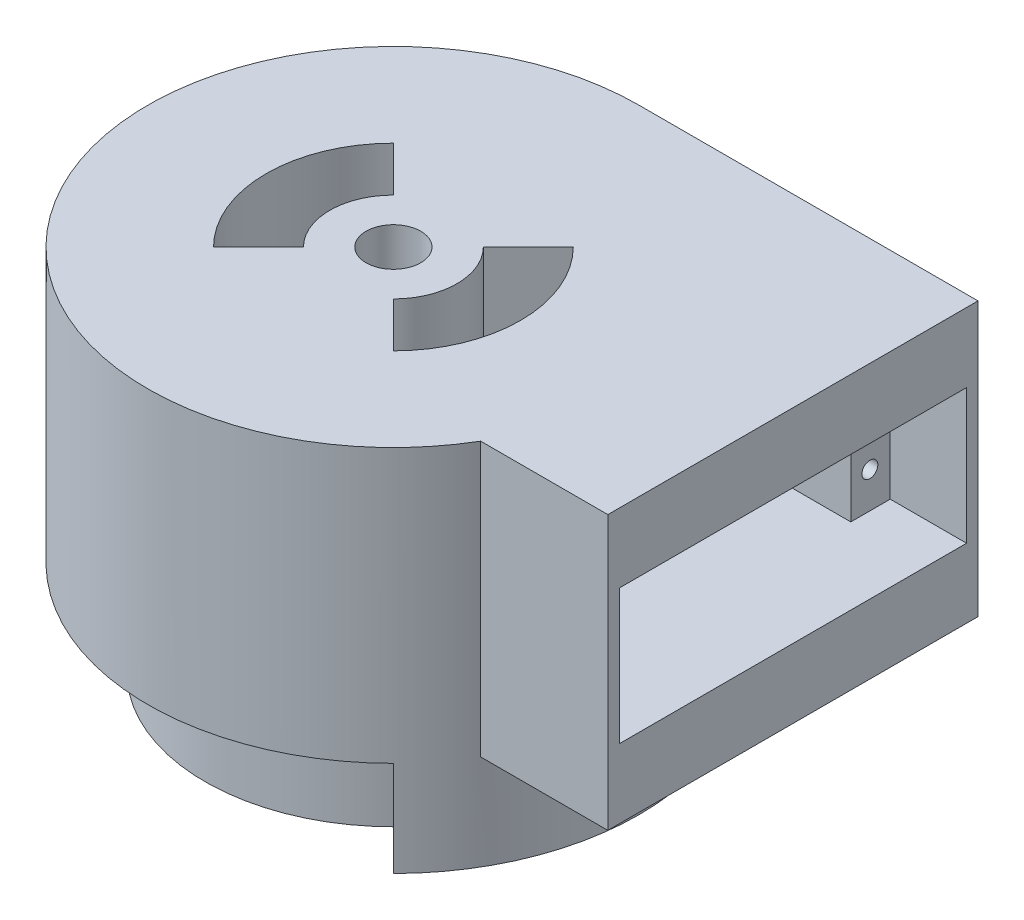
from build123d import *

# Parameters (mm, degrees)
BOSS_EXTRUDE1_DEPTH     = 43
BOSS_EXTRUDE2_START     = 15
BOSS_EXTRUDE2_DEPTH     = 15
SKETCH5_W               = 42.2
SKETCH5_H               = 21.2
CUT_EXTRUDE1_DEPTH      = 41
SKETCH5_5_W             = 6.2
SKETCH5_5_H             = 21.2
SKETCH5_5_R             = 1.25
CUT_EXTRUDE2_DEPTH      = 12
SKETCH5_6_R             = 1.25
CUT_EXTRUDE3_DEPTH      = 35
CUT_EXTRUDE4_DEPTH      = 88.729655833
CUT_EXTRUDE4_DEPTH_BACK = 88.729655833
SKETCH6_R               = 4.3
CUT_EXTRUDE5_START      = -5
SKETCH7_W               = 10
SKETCH7_H               = 6.8
CUT_EXTRUDE5_DEPTH      = 94.632977309


with BuildPart() as part:
    # Sketch1 → Boss-Extrude1 (new body)
    with BuildSketch(Plane(origin=(0, 0, 0), x_dir=(1, 0, 0), z_dir=(0, 1, 0))):
        with BuildLine():
            Line((0, 38.625), (53.297297188, 38.625))
            Line((53.297297188, 38.625), (53.297297188, -19.575))
            Line((53.297297188, -19.575), (33.297297188, -19.575))
            ThreePointArc((33.297297188, -19.575), (-33.525922806, -19.180800948), (0, 38.625))
        make_face()
    extrude(amount=BOSS_EXTRUDE1_DEPTH)

    # Sketch4 → Boss-Extrude2 (add)
    with BuildSketch(Plane.XZ.offset(BOSS_EXTRUDE2_START)):
        with BuildLine():
            Line((20.948038393, 20.948038393), (27.311999423, 27.311999423))
            ThreePointArc((27.311999423, 27.311999423), (38.625, 0), (27.311999423, -27.311999423))
            Line((27.311999423, -27.311999423), (20.948038393, -20.948038393))
            ThreePointArc((20.948038393, -20.948038393), (-29.625, 0), (20.948038393, 20.948038393))
        make_face()
    extrude(amount=-BOSS_EXTRUDE2_DEPTH)

    # Sketch5 → Cut-Extrude1 (cut)
    with BuildSketch(Plane(origin=(53.297297188, 0, 0), x_dir=(0, 0, -1), z_dir=(1, 0, 0))):
        with Locations((9.525, 21.5)):
            Rectangle(SKETCH5_W, SKETCH5_H)
    extrude(amount=-CUT_EXTRUDE1_DEPTH, mode=Mode.SUBTRACT)

    # Sketch5<5> → Cut-Extrude2 (cut)
    # profile 1 of 2: a face of its own
    with BuildSketch(Plane(origin=(53.297297188, 0, 0), x_dir=(0, 0, -1), z_dir=(1, 0, 0))):
        with Locations((-14.675, 21.5)):
            Rectangle(SKETCH5_5_W, SKETCH5_5_H)
        with Locations((-14.575, 16.55)):
            Circle(SKETCH5_5_R, mode=Mode.SUBTRACT)
        with Locations((-14.575, 26.45)):
            Circle(SKETCH5_5_R, mode=Mode.SUBTRACT)
    # profile 2 of 2: a face of its own
    with BuildSketch(Plane(origin=(53.297297188, 0, 0), x_dir=(0, 0, -1), z_dir=(1, 0, 0))):
        with Locations((33.725, 21.5)):
            Rectangle(SKETCH5_5_W, SKETCH5_5_H)
        with Locations((33.625, 16.55)):
            Circle(SKETCH5_5_R, mode=Mode.SUBTRACT)
        with Locations((33.625, 26.45)):
            Circle(SKETCH5_5_R, mode=Mode.SUBTRACT)
    extrude(amount=-CUT_EXTRUDE2_DEPTH, mode=Mode.SUBTRACT)

    # Sketch5<6> → Cut-Extrude3 (cut)
    with BuildSketch(Plane(origin=(53.297297188, 0, 0), x_dir=(0, 0, -1), z_dir=(1, 0, 0))):
        with Locations((-14.575, 26.45)):
            Circle(SKETCH5_6_R)
        with Locations((-14.575, 16.55)):
            Circle(SKETCH5_6_R)
        with Locations((33.625, 16.55)):
            Circle(SKETCH5_6_R)
        with Locations((33.625, 26.45)):
            Circle(SKETCH5_6_R)
    extrude(amount=-CUT_EXTRUDE3_DEPTH, mode=Mode.SUBTRACT)

    # Sketch6 → Cut-Extrude4 (cut, two sides: drawn at the far end of the back side and taken through both)
    with BuildSketch(Plane.XZ.offset(15).offset(-CUT_EXTRUDE4_DEPTH_BACK)):
        Circle(SKETCH6_R)
        with BuildLine():
            Line((7.071067812, 7.071067812), (14.142135624, 14.142135624))
            ThreePointArc((14.142135624, 14.142135624), (20, 0), (14.142135624, -14.142135624))
            Line((14.142135624, -14.142135624), (7.071067812, -7.071067812))
            ThreePointArc((7.071067812, -7.071067812), (10, 0), (7.071067812, 7.071067812))
        make_face()
        with BuildLine():
            Line((-7.071067812, -7.071067812), (-14.142135624, -14.142135624))
            ThreePointArc((-14.142135624, -14.142135624), (-20, 0), (-14.142135624, 14.142135624))
            Line((-14.142135624, 14.142135624), (-7.071067812, 7.071067812))
            ThreePointArc((-7.071067812, 7.071067812), (-10, 0), (-7.071067812, -7.071067812))
        make_face()
    extrude(amount=CUT_EXTRUDE4_DEPTH + CUT_EXTRUDE4_DEPTH_BACK, mode=Mode.SUBTRACT)

    # Sketch7 → Cut-Extrude5 (cut, through all)
    with BuildSketch(Plane(origin=(41.297297188, 0, 0), x_dir=(0, 0, -1), z_dir=(1, 0, 0)).offset(CUT_EXTRUDE5_START)):
        with Locations((30.625, 21.5)):
            Rectangle(SKETCH7_W, SKETCH7_H)
    extrude(amount=-CUT_EXTRUDE5_DEPTH, mode=Mode.SUBTRACT)


solid = part.part
